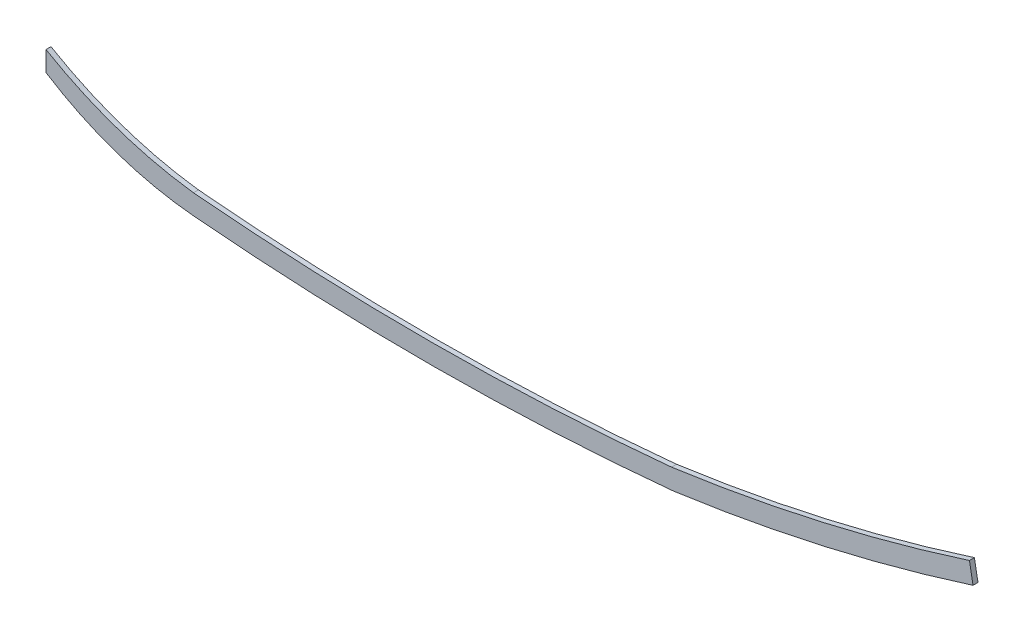
from build123d import *

# Parameters (mm, degrees)
BOSS_EXTRUDE1_DEPTH = 3.175


with BuildPart() as part:
    # Sketch2 → Boss-Extrude1 (new body)
    with BuildSketch(Plane.XY):
        with BuildLine():
            Line((0, -93.726), (0, -81.026))
            ThreePointArc((0, -81.026), (45.355574661, -101.848678718), (93.981781578, -113.082738659))
            ThreePointArc((93.981781578, -113.082738659), (246.372313094, -119.731502028), (398.720709803, -112.17861051))
            ThreePointArc((398.720709803, -112.17861051), (494.586291489, -94.575813643), (588.578984507, -68.779653684))
            Line((588.578984507, -68.779653684), (590.864339182, -81.353629169))
            ThreePointArc((590.864339182, -81.353629169), (496.464017617, -107.14437724), (400.203586993, -124.765753286))
            ThreePointArc((400.203586993, -124.765753286), (247.115945932, -132.400573942), (93.98, -125.805242584))
            ThreePointArc((93.98, -125.805242584), (45.058861039, -115.423125179), (0, -93.726))
        make_face()
    extrude(amount=-BOSS_EXTRUDE1_DEPTH)


solid = part.part
